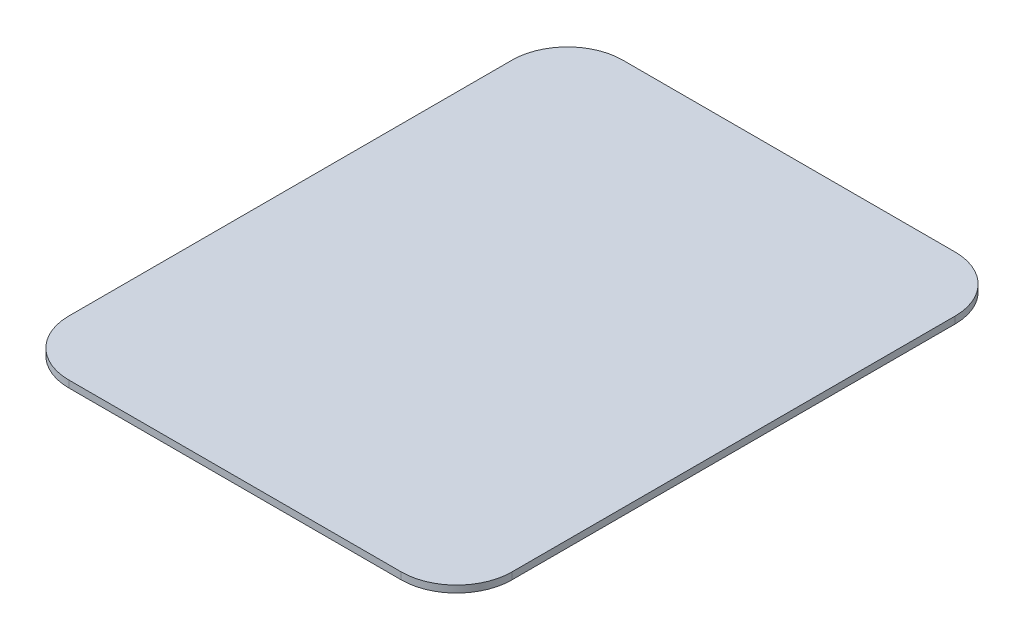
from build123d import *

# Parameters (mm, degrees)
SKETCH1_W           = 203.2
SKETCH1_H           = 254
BOSS_EXTRUDE1_DEPTH = 3.175
FILLET1_R           = 25.4


with BuildPart() as part:
    # Sketch1 → Boss-Extrude1 (new body)
    with BuildSketch(Plane(origin=(0, 0, 0), x_dir=(1, 0, 0), z_dir=(0, 1, 0))):
        Rectangle(SKETCH1_W, SKETCH1_H)
    extrude(amount=BOSS_EXTRUDE1_DEPTH)

    # Fillet1
    fillet1_edges = [part.edges().sort_by_distance(p)[0] for p in [
        (-101.6, 1.5875, -127),
        (-101.6, 1.5875, 127),
        (101.6, 1.5875, -127),
        (101.6, 1.5875, 127),
    ]]
    fillet(fillet1_edges, radius=FILLET1_R)


solid = part.part
